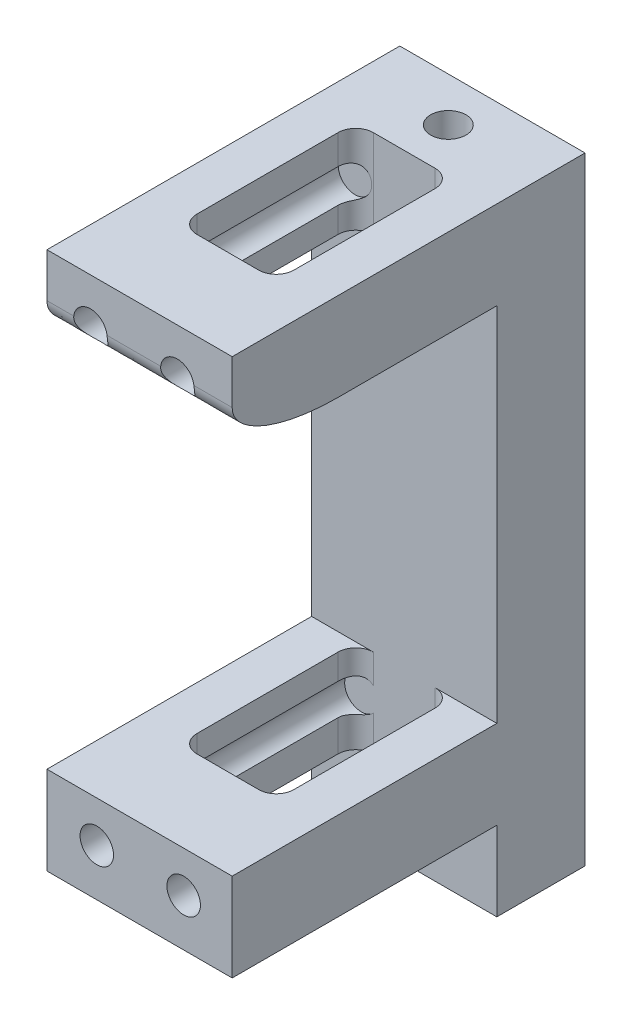
from build123d import *

# Parameters (mm, degrees)
AUFSATZ_LINEAR_AUSTRAGEN1_DEPTH     = 21
SKIZZE2_R                           = 1.5
SCHNITT_LINEAR_AUSTRAGEN1_DEPTH     = 86
SKIZZE3_R                           = 2
SCHNITT_LINEAR_AUSTRAGEN2_DEPTH     = 6
SCHNITT_LINEAR_START                = -6
SKIZZE4_R                           = 2
SCHNITT_LINEAR_AUSTRAGEN3_DEPTH     = 6
SCHNITT_LINEAR_AUSTRAGEN4_DEPTH     = 72
SCHNITT_LINEAR_START_2              = -30
SCHNITT_LINEAR_AUSTRAGEN5_OUTLINE_R = 1.9
SCHNITT_LINEAR_AUSTRAGEN5_DEPTH     = 30
VERRUNDUNG2_SIZE                    = 12
VERRUNDUNG2_SIZE_2                  = 5


# Read off the part's stored shape, not the designer's step: Schnitt-Linear austragen5
with BuildPart() as part:
    # Skizze1 → Aufsatz-Linear austragen1 (new body)
    with BuildSketch(Plane(origin=(0, 0, 0), x_dir=(0, 0, -1), z_dir=(1, 0, 0))):
        Polygon((-10, 19), (-10, 60), (-40, 60), (-40, 70), (-10, 70), (0, 70), (0, 0), (-10, 0), (-10, 9), (-40, 9), (-40, 19), align=None)
    extrude(amount=AUFSATZ_LINEAR_AUSTRAGEN1_DEPTH)

    # Skizze2 → Schnitt-Linear austragen1 (cut)
    with BuildSketch(Plane(origin=(0, 70, 0), x_dir=(1, 0, 0), z_dir=(0, 1, 0))):
        with Locations(Location((10.5, -5, 0), (0, 0, 270))):
            Circle(SKIZZE2_R)
    extrude(amount=-SCHNITT_LINEAR_AUSTRAGEN1_DEPTH, mode=Mode.SUBTRACT)

    # Skizze3 → Schnitt-Linear austragen2 (cut)
    with BuildSketch(Plane(origin=(0, 70, 0), x_dir=(1, 0, 0), z_dir=(0, 1, 0))):
        with Locations(Location((10.5, -5, 0), (0, 0, 270))):
            Circle(SKIZZE3_R)
    extrude(amount=-SCHNITT_LINEAR_AUSTRAGEN2_DEPTH, mode=Mode.SUBTRACT)

    # Skizze4 → Schnitt-Linear austragen3 (cut)
    with BuildSketch(Plane.XZ.offset(SCHNITT_LINEAR_START)):
        with Locations(Location((10.5, 5, 0), (0, 0, 90))):
            Circle(SKIZZE4_R)
    extrude(amount=SCHNITT_LINEAR_AUSTRAGEN3_DEPTH, mode=Mode.SUBTRACT)

    # Skizze5 → Schnitt-Linear austragen4 (cut)
    with BuildSketch(Plane.XZ.offset(-9)):
        with BuildLine():
            Line((7, 10), (14, 10))
            ThreePointArc((14, 10), (15.414213562, 10.585786438), (16, 12))
            Line((16, 12), (16, 28))
            ThreePointArc((16, 28), (15.414213562, 29.414213562), (14, 30))
            Line((14, 30), (7, 30))
            ThreePointArc((7, 30), (5.585786438, 29.414213562), (5, 28))
            Line((5, 28), (5, 12))
            ThreePointArc((5, 12), (5.585786438, 10.585786438), (7, 10))
        make_face()
    extrude(amount=-SCHNITT_LINEAR_AUSTRAGEN4_DEPTH, mode=Mode.SUBTRACT)

    # Schnitt-Linear austragen5 outline → Schnitt-Linear austragen5 (cut)
    with BuildSketch(Plane.XY.offset(40).offset(SCHNITT_LINEAR_START_2)):
        with Locations((14.775, 64.761145618)):
            Circle(SCHNITT_LINEAR_AUSTRAGEN5_OUTLINE_R)
        with Locations((4.925000267, 64.763441187)):
            Circle(SCHNITT_LINEAR_AUSTRAGEN5_OUTLINE_R)
        with Locations((5.65, 14.346358559)):
            Circle(SCHNITT_LINEAR_AUSTRAGEN5_OUTLINE_R)
        with Locations((15.5, 14.346358353)):
            Circle(SCHNITT_LINEAR_AUSTRAGEN5_OUTLINE_R)
    extrude(amount=SCHNITT_LINEAR_AUSTRAGEN5_DEPTH, mode=Mode.SUBTRACT)

    # Verrundung2
    # an asymmetric fillet: 12, 5 mm, written as the material it takes off along each edge
    with BuildSketch(Plane(origin=(-30, 60, 40), x_dir=(0, 0, -1), z_dir=(1, 0, 0))) as verrundung2_piece_1:
        with BuildLine():
            Bezier((VERRUNDUNG2_SIZE, 0), (0, 0), (0, VERRUNDUNG2_SIZE_2), weights=[1, 0.707106781, 1])
            Line((0, VERRUNDUNG2_SIZE_2), (0, 0))
            Line((0, 0), (VERRUNDUNG2_SIZE, 0))
        make_face()
    extrude(amount=81, mode=Mode.SUBTRACT)


solid = part.part
